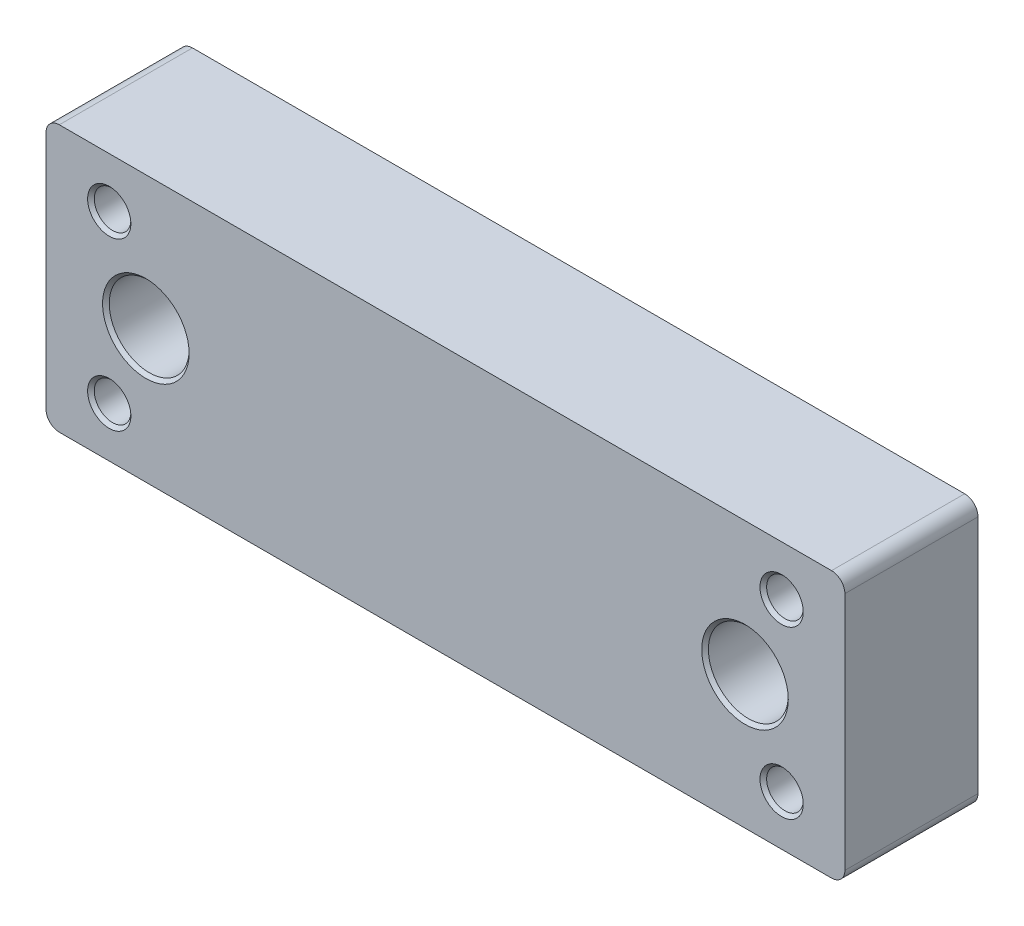
from build123d import *

# Parameters (mm, degrees)
SKETCH_1_W          = 120
SKETCH_1_H          = 40
EXTRUDE_1_DEPTH     = 20
SKETCH_2_R          = 6
SKETCH_2_R_2        = 2.75
CUT_EXTRUDE_1_DEPTH = 20
FILLET_1_R          = 2
CHAMFER_1_SIZE      = 0.5


with BuildPart() as part:
    # 草图1 → 凸台-拉伸1 (new body)
    with BuildSketch(Plane.XY):
        Rectangle(SKETCH_1_W, SKETCH_1_H)
    extrude(amount=EXTRUDE_1_DEPTH)

    # 草图2 → 切除-拉伸1 (cut)
    with BuildSketch(Plane.XY.offset(20)):
        with Locations((45, 0)):
            Circle(SKETCH_2_R)
        with Locations((50.5, 12.5)):
            Circle(SKETCH_2_R_2)
        with Locations((50.5, -12.5)):
            Circle(SKETCH_2_R_2)
        with Locations((-50.5, -12.5)):
            Circle(SKETCH_2_R_2)
        with Locations((-50.5, 12.5)):
            Circle(SKETCH_2_R_2)
        with Locations((-45, 0)):
            Circle(SKETCH_2_R)
    extrude(amount=-CUT_EXTRUDE_1_DEPTH, mode=Mode.SUBTRACT)

    # 圆角1
    fillet_1_edges = [part.edges().sort_by_distance(p)[0] for p in [
        (-60, 20, 10),
        (-60, -20, 10),
        (60, 20, 10),
        (60, -20, 10),
    ]]
    fillet(fillet_1_edges, radius=FILLET_1_R)

    # 倒角1
    chamfer_1_edges = [part.edges().sort_by_distance(p)[0] for p in [
        (47.75, -12.5, 20),
        (47.75, -12.5, 0),
        (47.75, 12.5, 20),
        (47.75, 12.5, 0),
        (39, 0, 20),
        (39, 0, 0),
        (-53.25, -12.5, 20),
        (-53.25, -12.5, 0),
        (-53.25, 12.5, 20),
        (-53.25, 12.5, 0),
        (-51, 0, 20),
        (-51, 0, 0),
    ]]
    chamfer(chamfer_1_edges, length=CHAMFER_1_SIZE)


solid = part.part
